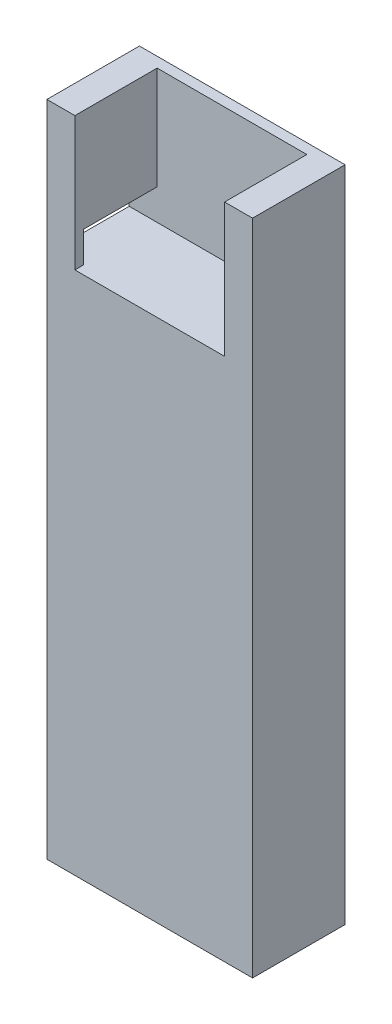
from build123d import *

# Parameters (mm, degrees)
SKETCH1_W           = 31.75
SKETCH1_H           = 14.2875
BOSS_EXTRUDE1_DEPTH = 101.6
SKETCH5_W           = 23.114
SKETCH5_H           = 12.7
CUT_EXTRUDE2_DEPTH  = 20.6375
SKETCH6_W           = 11.345737275
SKETCH6_H           = 4.7625
CUT_EXTRUDE4_DEPTH  = 9.2075
SHELL2_START        = -12.2555
SHELL2_OUTLINE_W    = 0.254
SHELL2_OUTLINE_H    = 11.811
SHELL2_DEPTH        = 10.2235


# Read off the part's stored shape, not the designer's step: Shell2
with BuildPart() as part:
    # Sketch1 → Boss-Extrude1 (new body)
    with BuildSketch(Plane(origin=(0, 0, 0), x_dir=(1, 0, 0), z_dir=(0, 1, 0))):
        with Locations((15.875, 7.14375)):
            Rectangle(SKETCH1_W, SKETCH1_H)
    extrude(amount=BOSS_EXTRUDE1_DEPTH)

    # Sketch5 → Cut-Extrude2 (cut)
    with BuildSketch(Plane(origin=(0, 101.6, 0), x_dir=(1, 0, 0), z_dir=(0, 1, 0))):
        with Locations((15.875, 6.35)):
            Rectangle(SKETCH5_W, SKETCH5_H)
    extrude(amount=-CUT_EXTRUDE2_DEPTH, mode=Mode.SUBTRACT)

    # Sketch6 → Cut-Extrude4 (cut)
    with BuildSketch(Plane.ZY):
        with Locations((-7.027131363, 83.34375)):
            Rectangle(SKETCH6_W, SKETCH6_H)
    extrude(amount=-CUT_EXTRUDE4_DEPTH, mode=Mode.SUBTRACT)

    # Shell2 outline → Shell2 (cut)
    with BuildSketch(Plane.XY.offset(SHELL2_START)):
        Polygon((2.032, 78.9305), (2.032, 0), (29.718, 0), (29.718, 99.568), (29.464, 99.568), (29.464, 78.9305), align=None)
        with Locations((2.159, 93.6625)):
            Rectangle(SHELL2_OUTLINE_W, SHELL2_OUTLINE_H)
    extrude(amount=SHELL2_DEPTH, mode=Mode.SUBTRACT)


solid = part.part
